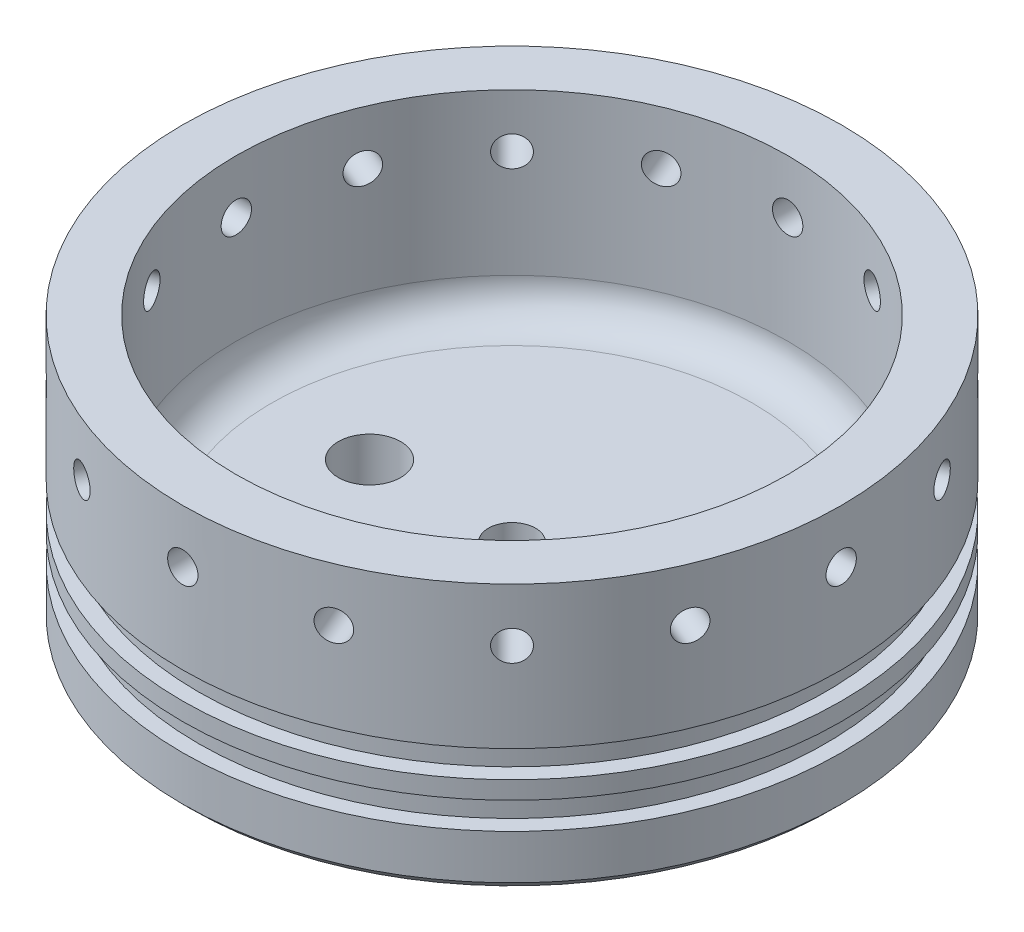
from build123d import *

# Parameters (mm, degrees)
FORWARDCLOSUREHOLES_D          = 5.4102
HOLEPATTERN_COUNT              = 16
CHAMFER1_SIZE                  = 1.5875
FILLET1_R                      = 6.35
PIPE_TAP_DRILL_FOR_1_8_TAP1_D  = 8.4328
PIPE_TAP_DRILL_FOR_1_16_TAP1_D = 6.1468
PIPE_TAP_DRILL_FOR_1_4_TAP1_D  = 11.1252


with BuildPart() as part:
    # Sketch1 → Revolve1 (revolve)
    with BuildSketch(Plane.XY):
        Polygon((0, 9.525), (0, 0), (58.7375, 0), (58.7375, 12.7), (9.525, 12.7), (9.525, 47.7012), (0, 47.7012), (0, 22.3012), (2.8194, 22.3012), (2.8194, 17.5006), (0, 17.5006), (0, 14.3256), (2.8194, 14.3256), (2.8194, 9.525), align=None)
    revolve(axis=Axis((58.7375, 0, 0), (0, 1, 0)))

    # ForwardClosureHoles (through all)
    with Locations(Plane.XY.offset(58.7375)):
        with Locations((58.7375, 38.1762)):
            forwardclosureholes = Hole(FORWARDCLOSUREHOLES_D / 2)

    # HolePattern: ForwardClosureHoles ×16 about axis
    holepattern_axis = Axis((58.7375, 47.7012, 0), (0, -1, 0))
    for i in range(1, HOLEPATTERN_COUNT):
        add(forwardclosureholes.rotate(holepattern_axis, i * 360 / HOLEPATTERN_COUNT), mode=Mode.SUBTRACT)

    # Chamfer1
    chamfer1_edges = [part.edges().sort_by_distance(p)[0] for p in [
        (117.475, 0, 0),
    ]]
    chamfer(chamfer1_edges, length=CHAMFER1_SIZE)

    # Fillet1
    fillet1_edges = [part.edges().sort_by_distance(p)[0] for p in [
        (107.95, 12.7, 0),
    ]]
    fillet(fillet1_edges, radius=FILLET1_R)

    # Pipe Tap Drill for 1/8 Tap1 (through all)
    with Locations(Plane(origin=(0, 12.7, 0), x_dir=(1, 0, 0), z_dir=(0, 1, 0))):
        with Locations((58.7375, 0)):
            Hole(PIPE_TAP_DRILL_FOR_1_8_TAP1_D / 2)

    # Pipe Tap Drill for 1/16 Tap1 (through all)
    with Locations(Plane(origin=(0, 12.7, 0), x_dir=(1, 0, 0), z_dir=(0, 1, 0))):
        with Locations((84.1375, 0)):
            Hole(PIPE_TAP_DRILL_FOR_1_16_TAP1_D / 2)

    # Pipe Tap Drill for 1/4 Tap1 (through all)
    with Locations(Plane(origin=(0, 12.7, 0), x_dir=(1, 0, 0), z_dir=(0, 1, 0))):
        with Locations((33.3375, 0)):
            Hole(PIPE_TAP_DRILL_FOR_1_4_TAP1_D / 2)


solid = part.part
